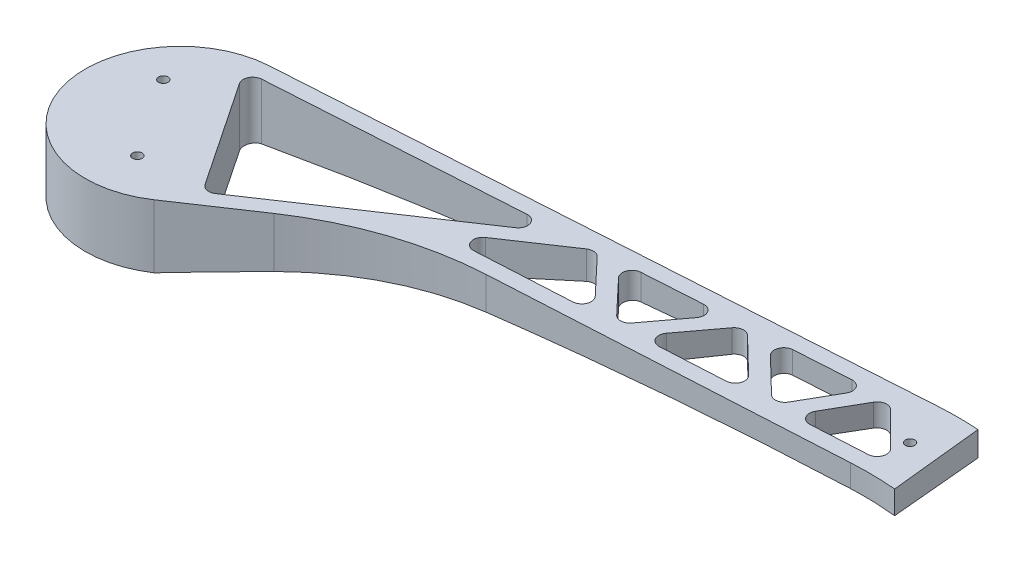
from build123d import *

# Parameters (mm, degrees)
SKETCH1_R               = 5
SKETCH1_R_2             = 2
BOSS_EXTRUDE1_DEPTH     = 20
FILLET1_R               = 100
CUT_EXTRUDE3_START      = -131
CUT_EXTRUDE3_DEPTH      = 431
FILLET3_R               = 5
SKETCH4_R               = 1.5
CUT_EXTRUDE4_DEPTH      = 114
FILLET4_R               = 3
CUT_EXTRUDE5_DEPTH      = 83
CUT_EXTRUDE6_DEPTH      = 150
CUT_EXTRUDE6_DEPTH_BACK = 140


# Read off the part's stored shape, not the designer's step: Mirror1
with BuildPart() as part:
    # Sketch1 → Boss-Extrude1 (new body)
    with BuildSketch(Plane(origin=(0, 0, 0), x_dir=(1, 0, 0), z_dir=(0, 1, 0))):
        with BuildLine():
            Line((0, 15), (-139.784941349, 43.225909045))
            Line((-139.784941349, 43.225909045), (-351.875415017, 29.941322925))
            ThreePointArc((-351.875415017, 29.941322925), (-378.412739548, -9.628926804), (-333.285739517, -24.912516864))
            Line((-333.285739517, -24.912516864), (-287.823465989, 5.588948968))
            Line((-287.823465989, 5.588948968), (-138.053278996, 13.889014505))
            Line((-138.053278996, 13.889014505), (-5.919683, -13.782501703))
            Line((-5.919683, -13.782501703), (0, -15))
            Line((0, -15), (40, -15))
            ThreePointArc((40, -15), (55, 0), (40, 15))
            Line((40, 15), (0, 15))
        make_face()
        with Locations(Location((0, 0, 0), (0, 0, 270))):
            Circle(SKETCH1_R, mode=Mode.SUBTRACT)
        with Locations(Location((40, 0, 0), (0, 0, 270))):
            Circle(SKETCH1_R_2, mode=Mode.SUBTRACT)
    extrude(amount=BOSS_EXTRUDE1_DEPTH)

    # Fillet1
    fillet1_edges = [part.edges().sort_by_distance(p)[0] for p in [
        (0, 10, -15),
        (-139.784941349, 10, -43.225909045),
        (-138.053278996, 10, -13.889014505),
        (-287.823465989, 10, -5.588948968),
        (0, 10, 15),
    ]]
    fillet(fillet1_edges, radius=FILLET1_R)

    # Sketch3 → Cut-Extrude3 (cut)
    with BuildSketch(Plane(origin=(-86.356848498, 0, -128.714426022), x_dir=(0.8304172287941746, 0, -0.557142016116002), z_dir=(0.557142016116002, 0, 0.8304172287941746)).offset(CUT_EXTRUDE3_START)):
        with BuildLine():
            Line((0.156842574, 20), (-290.646030078, 20))
            add(Edge.make_bspline(
                [(-290.646030078, 20), (-152.53466, -2.539392014), (-15.681609056, 14)],
                knots=[0, 0, 0, 1, 1, 1], degree=2))
            add(Edge.make_bspline(
                [(-15.681609056, 14), (1.778655923, 1.080988316), (32.031463633, 10), (48.216689152, 10)],
                knots=[0, 0, 0, 0, 1, 1, 1, 1], degree=3))
            Line((48.216689152, 10), (48.216689152, 20))
            Line((48.216689152, 20), (0.156842574, 20))
        make_face()
        with BuildLine():
            Line((0.156842574, 20), (-290.646030078, 20))
            add(Edge.make_bspline(
                [(-290.646030078, 20), (-152.53466, -2.539392014), (-15.681609056, 14)],
                knots=[0, 0, 0, 1, 1, 1], degree=2))
            add(Edge.make_bspline(
                [(-15.681609056, 14), (1.778655923, 1.080988316), (32.031463633, 10), (48.216689152, 10)],
                knots=[0, 0, 0, 0, 1, 1, 1, 1], degree=3))
            Line((48.216689152, 10), (48.216689152, 20))
            Line((48.216689152, 20), (0.156842574, 20))
        make_face()
    extrude(amount=CUT_EXTRUDE3_DEPTH, mode=Mode.SUBTRACT)

    # Fillet3
    fillet3_edges = [part.edges().sort_by_distance(p)[0] for p in [
        (-21.864392185, 14, -4.442240649),
    ]]
    fillet(fillet3_edges, radius=FILLET3_R)

    # Sketch4 → Cut-Extrude4 (cut)
    with BuildSketch(Plane(origin=(0, 0, 0), x_dir=(1, 0, 0), z_dir=(0, 1, 0))):
        with Locations(Location((-147.336246923, 28.050603479, 0), (0, 0, 90))):
            Circle(SKETCH4_R)
        with Locations(Location((-130.791911053, 26.905656844, 0), (0, 0, 90))):
            Circle(SKETCH4_R)
        with Locations(Location((-364.746711272, 9.415773639, 0), (0, 0, 270))):
            Circle(SKETCH4_R)
        with Locations(Location((-348.032450789, -15.496743225, 0), (0, 0, 270))):
            Circle(SKETCH4_R)
        Polygon((-23.866128519, -4.915677567), (-39.103088127, 17.794930154), (-75.639684705, 5.926779178), align=None)
        Polygon((-49.0834237, 19.810197617), (-105.838380632, 31.270375206), (-85.479969978, 7.987539058), align=None)
        Polygon((-113.9043748, 32.899091544), (-93.610691693, 9.690280862), (-134.183540545, 18.187077125), align=None)
        Polygon((-143.989822428, 18.567691314), (-162.24368626, 36.809375165), (-173.639207374, 16.924561642), align=None)
        Polygon((-168.221096355, 36.434971648), (-179.591082035, 16.594716626), (-198.135268167, 34.561255282), align=None)
        Polygon((-186.387937739, 16.218043878), (-204.884563485, 34.138503645), (-219.662547376, 14.374009052), align=None)
        Polygon((-211.434434242, 33.728243247), (-226.175542257, 14.013067496), (-242.935285915, 31.755142949), align=None)
        Polygon((-232.71148459, 13.650854223), (-279.687517615, 11.047504647), (-249.429154901, 31.348390301), align=None)
        Polygon((-259.327642719, 30.728384548), (-327.767277309, -15.189010559), (-354.571570516, 24.762646722), align=None)
    extrude(amount=CUT_EXTRUDE4_DEPTH, mode=Mode.SUBTRACT)

    # Fillet4
    fillet4_edges = [part.edges().sort_by_distance(p)[0] for p in [
        (-23.866128519, 6.59687861, 4.915677567),
        (-75.639684705, 4.853769064, -5.926779178),
        (-39.103088127, 6.59687861, -17.794930154),
        (-49.0834237, 6.203132148, -19.810197617),
        (-85.479969978, 4.603063185, -7.987539058),
        (-105.838380632, 4.473862314, -31.270375206),
        (-93.610691693, 4.415303992, -9.690280862),
        (-134.183540545, 3.740248049, -18.187077125),
        (-113.9043748, 4.298352255, -32.899091544),
        (-143.989822428, 3.631366763, -18.567691314),
        (-173.639207374, 3.502352989, -16.924561642),
        (-162.24368626, 3.579543024, -36.809375165),
        (-179.591082035, 3.517150778, -16.594716626),
        (-198.135268167, 3.547363849, -34.561255282),
        (-168.221096355, 3.539514704, -36.434971648),
        (-204.884563485, 3.597054187, -34.138503645),
        (-186.387937739, 3.550671331, -16.218043878),
        (-219.662547376, 3.97020999, -14.374009052),
        (-242.935285915, 4.206596653, -31.755142949),
        (-226.175542257, 4.101905497, -14.013067496),
        (-211.434434242, 3.662123803, -33.728243247),
        (-279.687517615, 5.796823139, -11.047504647),
        (-232.71148459, 4.250360261, -13.650854223),
        (-249.429154901, 4.366437166, -31.348390301),
        (-259.327642719, 4.641338109, -30.728384548),
        (-354.571570516, 9.209496695, -24.762646722),
        (-327.767277309, 9.209496695, 15.189010559),
    ]]
    fillet(fillet4_edges, radius=FILLET4_R)

    # Sketch5 → Cut-Extrude5 (cut)
    with BuildSketch(Plane(origin=(0, 0, 0), x_dir=(1, 0, 0), z_dir=(0, 1, 0))):
        Polygon((-149.224964635, 128.266447682), (-126.011497046, -92.59494321), (104.726225705, -43.123683348), (52.275964972, 176.408673493), align=None)
    extrude(amount=CUT_EXTRUDE5_DEPTH, mode=Mode.SUBTRACT)

    # Mirror1: part across plane


with BuildPart() as part_1:
    add(part.part)
    add(part.part.mirror(Plane.ZX))

    # Sketch6 → Cut-Extrude6 (cut, two sides: drawn at the far end of the back side and taken through both)
    with BuildSketch(Plane.XY.offset(-CUT_EXTRUDE6_DEPTH_BACK)):
        Polygon((0, 0), (-407.335176801, 0), (-388.737302516, 101.491256814), (-53.975565382, 72.797393631), align=None)
    extrude(amount=CUT_EXTRUDE6_DEPTH + CUT_EXTRUDE6_DEPTH_BACK, mode=Mode.SUBTRACT)


solid = part_1.part
